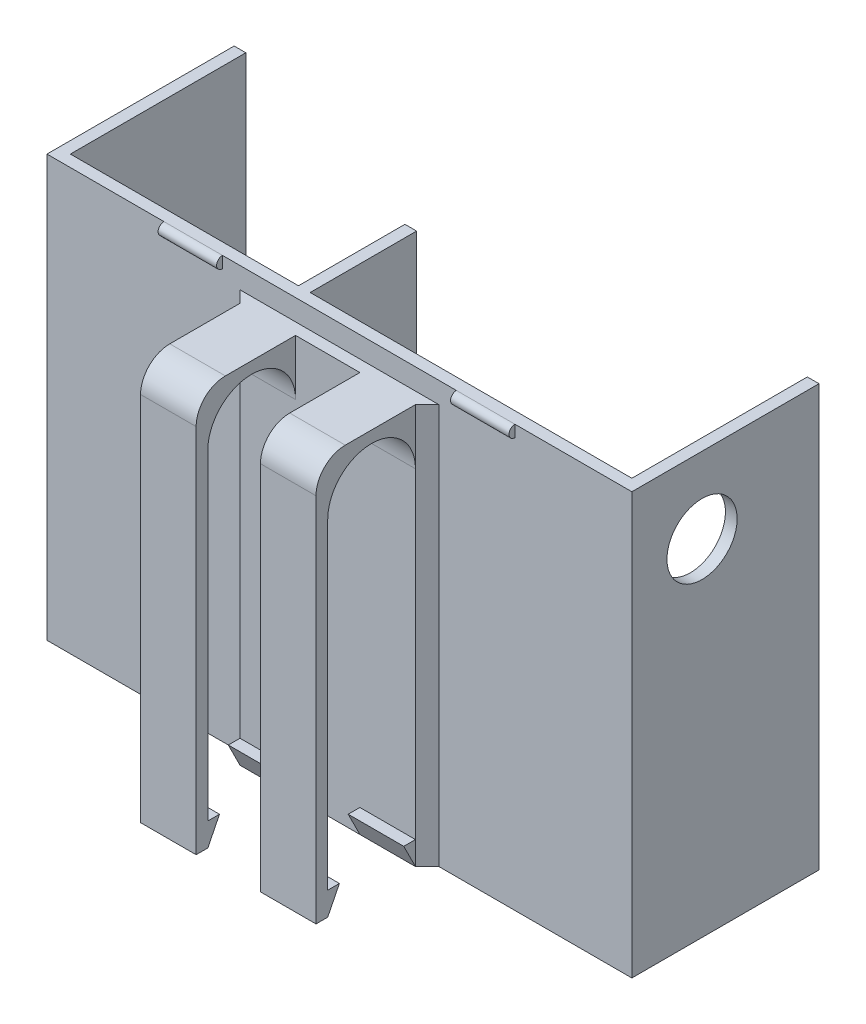
from build123d import *

# Parameters (mm, degrees)
BOSS_EXTRUDE1_DEPTH      = 30
FILLET1_R                = 5
SKETCH2_W                = 11
SKETCH2_H                = 68.4
CUT_EXTRUDE1_DEPTH       = 17
BOSS_EXTRUDE3_DEPTH      = 2
BOSS_EXTRUDE4_DEPTH      = 32
SKETCH4_W                = 2
SKETCH4_H                = 70
BOSS_EXTRUDE5_DEPTH      = 18.2
BOSS_EXTRUDE6_DEPTH      = 10
BOSS_EXTRUDE6_DEPTH_BACK = 10
BOSS_EXTRUDE7_START      = 20
BOSS_EXTRUDE7_DEPTH      = 10
BOSS_EXTRUDE8_START      = -30
BOSS_EXTRUDE8_DEPTH      = 10
CHAMFER1_SIZE            = 2
CUT_EXTRUDE2_REACH       = 134.608
SKETCH6_R                = 6


with BuildPart() as part:
    # Sketch1 → Boss-Extrude1 (new body)
    with BuildSketch(Plane(origin=(0, 0, 0), x_dir=(0, 0, -1), z_dir=(1, 0, 0))):
        with BuildLine():
            ThreePointArc((-2, 58.9), (7.5, 68.4), (17, 58.9))
            Line((17, 58.9), (17, 0))
            Line((17, 0), (15, 0))
            Line((15, 0), (15, 58.9))
            ThreePointArc((15, 58.9), (7.5, 66.4), (0, 58.9))
            Line((0, 58.9), (0, 0))
            Line((0, 0), (-2, 0))
            Line((-2, 0), (-2, 58.9))
        make_face()
        with BuildLine():
            Line((-2, 0), (0, 0))
            Line((0, 0), (0, 4))
            Line((0, 4), (0, 58.9))
            ThreePointArc((0, 58.9), (2.196699141, 64.203300859), (7.5, 66.4))
            Line((7.5, 66.4), (7.5, 68.4))
            ThreePointArc((7.5, 68.4), (0.782485579, 65.617514421), (-2, 58.9))
            Line((-2, 58.9), (-2, 0))
        make_face()
        Polygon((0, 4), (0, 0), (2, 4), align=None)
        Polygon((15, 0), (15, 4), (13, 4), align=None)
        with BuildLine():
            Line((17, 68.4), (7.5, 68.4))
            ThreePointArc((7.5, 68.4), (14.217514421, 65.617514421), (17, 58.9))
            Line((17, 58.9), (17, 68.4))
        make_face()
        with BuildLine():
            Line((-2, 68.4), (-2, 58.9))
            ThreePointArc((-2, 58.9), (0.782485579, 65.617514421), (7.5, 68.4))
            Line((7.5, 68.4), (-2, 68.4))
        make_face()
    extrude(amount=-BOSS_EXTRUDE1_DEPTH)

    # Fillet1
    fillet1_edges = [part.edges().sort_by_distance(p)[0] for p in [
        (-15, 68.4, 2),
    ]]
    fillet(fillet1_edges, radius=FILLET1_R)

    # Sketch2 → Cut-Extrude1 (cut)
    with BuildSketch(Plane.XY.offset(2)):
        with Locations((-15, 34.2)):
            Rectangle(SKETCH2_W, SKETCH2_H)
    extrude(amount=-CUT_EXTRUDE1_DEPTH, mode=Mode.SUBTRACT)

    # Sketch3 → Boss-Extrude3 (add)
    with BuildSketch(Plane(origin=(0, 0, -17), x_dir=(-1, 0, 0), z_dir=(0, 0, -1))):
        Polygon((-33, 2), (0, 2), (0, 0), (65, 0), (65, 72), (-33, 72), align=None)
    extrude(amount=BOSS_EXTRUDE3_DEPTH)

    # Sketch3<3> → Boss-Extrude4 (add)
    with BuildSketch(Plane(origin=(0, 0, -17), x_dir=(-1, 0, 0), z_dir=(0, 0, -1))):
        Polygon((65, 72), (63, 72), (63, 2), (-33, 2), (-33, 72), (-35, 72), (-35, 0), (65, 0), align=None)
    extrude(amount=BOSS_EXTRUDE4_DEPTH)

    # Sketch4 → Boss-Extrude5 (add)
    with BuildSketch(Plane(origin=(0, 0, -19), x_dir=(-1, 0, 0), z_dir=(0, 0, -1))):
        with Locations((23, 37)):
            Rectangle(SKETCH4_W, SKETCH4_H)
    extrude(amount=BOSS_EXTRUDE5_DEPTH)

    # Sketch5 → Boss-Extrude6 (add, two sides: drawn at the far end of the back side and taken through both)
    with BuildSketch(Plane.ZY.offset(15).offset(-BOSS_EXTRUDE6_DEPTH_BACK)):
        with BuildLine():
            Line((-48.8, 0), (-46.8, 0))
            ThreePointArc((-46.8, 0), (-47.8, -1), (-48.8, 0))
        make_face()
    extrude(amount=BOSS_EXTRUDE6_DEPTH + BOSS_EXTRUDE6_DEPTH_BACK)

    # Sketch5<3> → Boss-Extrude7 (add)
    with BuildSketch(Plane.ZY.offset(15).offset(BOSS_EXTRUDE7_START)):
        with BuildLine():
            ThreePointArc((-17, 72), (-16, 71), (-17, 70))
            Line((-17, 70), (-17, 72))
        make_face()
    extrude(amount=BOSS_EXTRUDE7_DEPTH)

    # Sketch5<4> → Boss-Extrude8 (add)
    with BuildSketch(Plane.ZY.offset(15).offset(BOSS_EXTRUDE8_START)):
        with BuildLine():
            ThreePointArc((-17, 72), (-16, 71), (-17, 70))
            Line((-17, 70), (-17, 72))
        make_face()
    extrude(amount=BOSS_EXTRUDE8_DEPTH)

    # Chamfer1
    chamfer1_edges = [part.edges().sort_by_distance(p)[0] for p in [
        (-30, 34.2, -17),
        (0, 34.2, -17),
    ]]
    chamfer(chamfer1_edges, length=CHAMFER1_SIZE - 0.0001)  # a hair under: the kernel refuses the full size

    # Sketch6 → Cut-Extrude2 (cut, up to next)
    with BuildSketch(Plane(origin=(35, 0, 0), x_dir=(0, 0, -1), z_dir=(1, 0, 0)), mode=Mode.PRIVATE) as cut_extrude2_sk1:
        with Locations(Location((29, 59, 0), (0, 0, 90))):
            Circle(SKETCH6_R)
    cut_extrude2_tool1 = extrude(cut_extrude2_sk1.sketch, amount=-CUT_EXTRUDE2_REACH, mode=Mode.PRIVATE) & part.part
    add(cut_extrude2_tool1.solids().sort_by_distance((35, 59, -29))[0], mode=Mode.SUBTRACT)


solid = part.part
